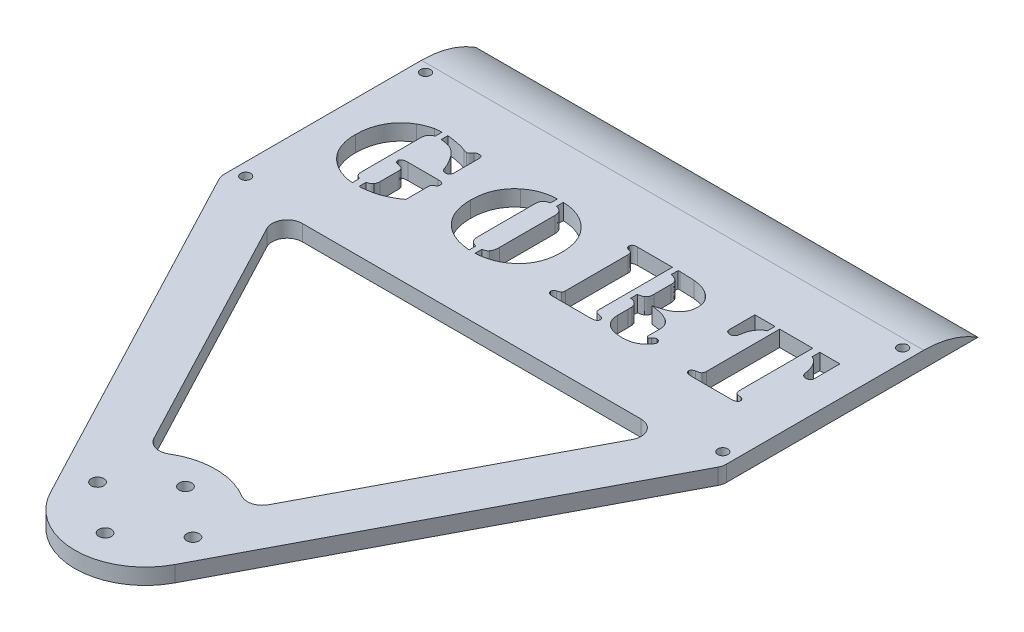
from build123d import *

# Parameters (mm, degrees)
BOSS_EXTRUDE1_DEPTH = 3.175
FILLET1_R           = 3
FILLET2_R           = 3
SKETCH2_R           = 1.25
CUT_EXTRUDE1_DEPTH  = 8.570402194
SKETCH3_R           = 1
CUT_EXTRUDE2_DEPTH  = 116.803646963
FILLET4_R           = 20
CUT_EXTRUDE3_DEPTH  = 3.175


with BuildPart() as part:
    # Sketch1 → Boss-Extrude1 (new body)
    with BuildSketch(Plane(origin=(0, 0, 0), x_dir=(1, 0, 0), z_dir=(0, 1, 0))):
        with BuildLine():
            Line((50, -25.405), (50, 25.405))
            Line((50, 25.405), (-50, 25.405))
            Line((-50, 25.405), (-50, -25.405))
            Line((-50, -25.405), (-12.391082111, -96.921217009))
            ThreePointArc((-12.391082111, -96.921217009), (0, -104.405), (12.391082111, -96.921217009))
            Line((12.391082111, -96.921217009), (50, -25.405))
        make_face()
        with BuildLine():
            Line((-38.70155175, -25.405), (-9.784896684, -80.392218324))
            ThreePointArc((-9.784896684, -80.392218324), (0, -76.405), (9.784896684, -80.392218324))
            Line((9.784896684, -80.392218324), (38.70155175, -25.405))
            Line((38.70155175, -25.405), (-38.70155175, -25.405))
        make_face(mode=Mode.SUBTRACT)
    extrude(amount=BOSS_EXTRUDE1_DEPTH)

    # Fillet1
    fillet1_edges = [part.edges().sort_by_distance(p)[0] for p in [
        (38.70155175, 1.5875, 25.405),
        (-38.70155175, 1.5875, 25.405),
        (-9.784896684, 1.5875, 80.392218324),
        (9.784896684, 1.5875, 80.392218324),
    ]]
    fillet(fillet1_edges, radius=FILLET1_R)

    # Fillet2
    fillet2_edges = [part.edges().sort_by_distance(p)[0] for p in [
        (50, 1.5875, 25.405),
        (-50, 1.5875, 25.405),
    ]]
    fillet(fillet2_edges, radius=FILLET2_R)

    # Sketch2 → Cut-Extrude1 (cut)
    with BuildSketch(Plane(origin=(0, 3.175, 0), x_dir=(1, 0, 0), z_dir=(0, 1, 0))):
        with Locations(Location((0, -82.405, 0), (0, 0, 270))):
            Circle(SKETCH2_R)
        with Locations(Location((0, -98.405, 0), (0, 0, 270))):
            Circle(SKETCH2_R)
        with Locations(Location((-9.5, -90.405, 0), (0, 0, 270))):
            Circle(SKETCH2_R)
        with Locations(Location((9.5, -90.405, 0), (0, 0, 270))):
            Circle(SKETCH2_R)
    extrude(amount=-CUT_EXTRUDE1_DEPTH, mode=Mode.SUBTRACT)

    # Sketch3 → Cut-Extrude2 (cut, through all)
    with BuildSketch(Plane(origin=(0, 3.175, 0), x_dir=(1, 0, 0), z_dir=(0, 1, 0))):
        with Locations(Location((47.5, 12.905, 0), (0, 0, 270))):
            Circle(SKETCH3_R)
        with Locations(Location((47.5, -22.905, 0), (0, 0, 270))):
            Circle(SKETCH3_R)
        with Locations(Location((-47.5, -22.905, 0), (0, 0, 90))):
            Circle(SKETCH3_R)
        with Locations(Location((-47.5, 12.905, 0), (0, 0, 90))):
            Circle(SKETCH3_R)
    extrude(amount=-CUT_EXTRUDE2_DEPTH, mode=Mode.SUBTRACT)

    # Fillet4
    # the kernel refuses this fillet: 20 mm, written as the material it takes off along each edge
    with BuildSketch(Plane(origin=(77.03231573, 3.175, -25.405), x_dir=(0, -1, 0), z_dir=(-1, 0, 0))) as fillet4_piece_1:
        with BuildLine():
            CenterArc((20, 10.812926292), FILLET4_R, 180, 32.727647126)
            Line((0, 10.812926292), (-0.4, 10.812926292))
            Line((-0.4, 10.812926292), (-0.4, 0))
            Line((-0.4, 0), (0, -0.4))
            ThreePointArc((0, -0.4), (1.5875, -0.4), (2.8385, -0.216258526))
            Line((2.8385, -0.216258526), (3.175, 0))
        make_face()
    extrude(amount=154.064631461, mode=Mode.SUBTRACT)

    # Sketch4 → Cut-Extrude3 (cut)
    with BuildSketch(Plane(origin=(0, 3.175, 0), x_dir=(1, 0, 0), z_dir=(0, 1, 0))):
        with BuildLine():
            Line((-35.551318359, 4.227423078), (-35.551318359, 2.835025833))
            add(Edge.make_bspline(
                [(-35.551318359, 2.835025833), (-35.644482488, 2.810458632), (-35.824763328, 2.762918921), (-36.067026955, 2.634129941), (-36.275114098, 2.470452994), (-36.442006407, 2.263629621), (-36.571768546, 2.020385158), (-36.66307896, 1.7395052), (-36.717902362, 1.420267767), (-36.723833534, 1.194265721), (-36.726957194, 1.075241452)],
                knots=[0, 0, 0, 0, 0.995196462, 1.925793303, 2.819334727, 3.720855559, 4.657399867, 5.660328629, 6.767809053, 8, 8, 8, 8], degree=3))
            Line((-36.726957194, 1.075241452), (-36.726957194, -10.446019127))
            add(Edge.make_bspline(
                [(-36.726957194, -10.446019127), (-36.725919843, -10.550330551), (-36.723957967, -10.747608251), (-36.681251214, -11.022791008), (-36.623911627, -11.263701748), (-36.556624577, -11.402094161), (-36.524894269, -11.467355365)],
                knots=[0, 0, 0, 0, 1.188853967, 2.248405465, 3.174006982, 4, 4, 4, 4], degree=3))
            add(Edge.make_bspline(
                [(-36.524894269, -11.467355365), (-36.490321987, -11.517104546), (-36.415804347, -11.624334714), (-36.246062205, -11.753224239), (-36.035110003, -11.875353938), (-35.873244949, -11.939794099), (-35.786446126, -11.974349612)],
                knots=[0, 0, 0, 0, 0.793365653, 1.71003282, 2.772023667, 4, 4, 4, 4], degree=3))
            Line((-35.786446126, -11.974349612), (-35.786446126, -13.366746857))
            add(Edge.make_bspline(
                [(-35.786446126, -13.366746857), (-35.935949149, -13.364296094), (-36.223548095, -13.359581563), (-36.580877702, -13.319809039), (-36.866838239, -13.261554163), (-37.110379585, -13.212116145), (-37.385260463, -13.140219806), (-37.579370829, -13.086558499), (-37.682163747, -13.058141663)],
                knots=[0, 0, 0, 0, 1.395569607, 2.684657092, 3.348359387, 4.119723616, 5.004282452, 6, 6, 6, 6], degree=3))
            add(Edge.make_bspline(
                [(-37.682163747, -13.058141663), (-37.934913895, -12.978278893), (-38.43623063, -12.819875253), (-39.15334406, -12.502285478), (-39.838199906, -12.135950476), (-40.478851961, -11.705733596), (-41.07569998, -11.224246792), (-41.618738372, -10.695078311), (-42.111272853, -10.122509878), (-42.391150203, -9.706856098), (-42.53167394, -9.498160317)],
                knots=[0, 0, 0, 0, 1.033972649, 2.050830823, 3.056106126, 4.062392446, 5.058304463, 6.045401141, 7.018614633, 8, 8, 8, 8], degree=3))
            add(Edge.make_bspline(
                [(-42.53167394, -9.498160317), (-42.632476635, -9.32948739), (-42.834209314, -8.991928543), (-43.086420911, -8.456241808), (-43.300131698, -7.898427564), (-43.477031094, -7.317991248), (-43.611618353, -6.713378401), (-43.7112912, -6.087832297), (-43.77146804, -5.438497328), (-43.777646509, -4.997796528), (-43.780790202, -4.77356175)],
                knots=[0, 0, 0, 0, 0.951873334, 1.904948656, 2.865002532, 3.845083325, 4.842920617, 5.86455084, 6.913453372, 8, 8, 8, 8], degree=3))
            add(Edge.make_bspline(
                [(-43.780790202, -4.77356175), (-43.776999477, -4.556711112), (-43.769514401, -4.12852297), (-43.71797123, -3.495315363), (-43.629268678, -2.880936207), (-43.508168271, -2.284672289), (-43.35441886, -1.706147511), (-43.164132867, -1.147054418), (-42.933349976, -0.608596573), (-42.674181567, -0.08720613), (-42.38100001, 0.41137186), (-42.057053062, 0.882897191), (-41.702887813, 1.32685836), (-41.31568953, 1.740134201), (-40.90450632, 2.133345972), (-40.456660396, 2.493020801), (-39.981141581, 2.828186929), (-39.644249337, 3.025927531), (-39.47501297, 3.12526167)],
                knots=[0, 0, 0, 0, 1.100647148, 2.173311833, 3.222026229, 4.249676371, 5.259883668, 6.258454349, 7.244409032, 8.231245038, 9.212013345, 10.17753562, 11.132758697, 12.0915749, 13.050108985, 14.017969405, 15.004335469, 16, 16, 16, 16], degree=3))
            add(Edge.make_bspline(
                [(-39.47501297, 3.12526167), (-39.273428229, 3.23409929), (-38.869378245, 3.45224992), (-38.231977677, 3.716063215), (-37.576256597, 3.941357253), (-37.125993101, 4.048597734), (-36.899629148, 4.102511452)],
                knots=[0, 0, 0, 0, 0.993812745, 1.991966358, 2.990487933, 4, 4, 4, 4], degree=3))
            add(Edge.make_bspline(
                [(-36.899629148, 4.102511452), (-36.80063764, 4.122090554), (-36.593882294, 4.162983799), (-36.268612488, 4.201910373), (-35.917784073, 4.223416452), (-35.676261966, 4.22605705), (-35.551318359, 4.227423078)],
                knots=[0, 0, 0, 0, 0.892340915, 1.863758392, 2.894884881, 4, 4, 4, 4], degree=3))
        make_face()
        with BuildLine():
            Line((-34.375679525, 2.860742933), (-34.375679525, 4.216401464))
            add(Edge.make_bspline(
                [(-34.375679525, 4.216401464), (-34.17714617, 4.198131653), (-33.788010649, 4.16232189), (-33.218654428, 4.087277081), (-32.675815452, 4.003733863), (-32.15963083, 3.908750854), (-31.6714535, 3.799804981), (-31.211463495, 3.673100498), (-30.776129977, 3.539952294), (-30.499216457, 3.434161818), (-30.363812002, 3.382432665)],
                knots=[0, 0, 0, 0, 1.163685748, 2.280883529, 3.351555557, 4.369452757, 5.344085038, 6.270107875, 7.154121834, 8, 8, 8, 8], degree=3))
            add(Edge.make_bspline(
                [(-30.363812002, 3.382432665), (-30.290631545, 3.353412981), (-30.154062165, 3.29925644), (-29.960698114, 3.236624491), (-29.793660995, 3.195159507), (-29.690449365, 3.190036351), (-29.643733215, 3.187717483)],
                knots=[0, 0, 0, 0, 1.259126468, 2.349782029, 3.253070317, 4, 4, 4, 4], degree=3))
            add(Edge.make_bspline(
                [(-29.643733215, 3.187717483), (-29.571905961, 3.190016523), (-29.443294277, 3.194133114), (-29.288700456, 3.261476502), (-29.181883669, 3.361494547), (-29.069253174, 3.474175809), (-28.925329709, 3.631588814), (-28.818272145, 3.749776026), (-28.758330218, 3.815949486)],
                knots=[0, 0, 0, 0, 1.137563862, 2.036887059, 2.603993634, 3.459282898, 4.57744306, 6, 6, 6, 6], degree=3))
            add(Edge.make_bspline(
                [(-28.758330218, 3.815949486), (-28.712331625, 3.863314287), (-28.622888303, 3.955414172), (-28.460496391, 4.057521796), (-28.278969128, 4.119396022), (-28.151411508, 4.12523491), (-28.086011759, 4.128228551)],
                knots=[0, 0, 0, 0, 1.032013047, 2.006728211, 2.978034608, 4, 4, 4, 4], degree=3))
            add(Edge.make_bspline(
                [(-28.086011759, 4.128228551), (-28.020867834, 4.126684914), (-27.900610614, 4.123835325), (-27.736356918, 4.08950007), (-27.597993973, 4.041159256), (-27.491421193, 3.960082319), (-27.409929352, 3.856883757), (-27.35966956, 3.723944909), (-27.32690302, 3.566534181), (-27.323604043, 3.451216004), (-27.321846517, 3.389780408)],
                knots=[0, 0, 0, 0, 1.261601348, 2.328945804, 3.246931812, 4.078733302, 4.89164726, 5.765503508, 6.80957516, 8, 8, 8, 8], degree=3))
            Line((-27.321846517, 3.389780408), (-27.321846517, -1.489120756))
            add(Edge.make_bspline(
                [(-27.321846517, -1.489120756), (-27.324997605, -1.565163393), (-27.330884206, -1.70721993), (-27.365163118, -1.906875931), (-27.431924899, -2.075511073), (-27.524902768, -2.215918953), (-27.646191545, -2.325496286), (-27.794282695, -2.405348482), (-27.969846889, -2.447508292), (-28.094379186, -2.452656995), (-28.159489187, -2.455348923)],
                knots=[0, 0, 0, 0, 1.247808372, 2.331051901, 3.304461783, 4.201305603, 5.068654161, 5.958272535, 6.932510852, 8, 8, 8, 8], degree=3))
            add(Edge.make_bspline(
                [(-28.159489187, -2.455348923), (-28.224623075, -2.453911047), (-28.347516192, -2.451198097), (-28.518659523, -2.413412927), (-28.664639981, -2.356481124), (-28.788639516, -2.269827721), (-28.890918165, -2.142790738), (-28.982338175, -1.975348896), (-29.080397057, -1.767913786), (-29.13357512, -1.611051309), (-29.162456067, -1.525859469)],
                knots=[0, 0, 0, 0, 1.037579167, 1.95768043, 2.781618297, 3.524611212, 4.342966149, 5.358777452, 6.565554926, 8, 8, 8, 8], degree=3))
            add(Edge.make_bspline(
                [(-29.162456067, -1.525859469), (-29.206032291, -1.402718565), (-29.298076873, -1.142612195), (-29.480206806, -0.745971593), (-29.711350217, -0.324668838), (-29.972078726, 0.116208669), (-30.252533857, 0.546734054), (-30.536666932, 0.940617046), (-30.808690556, 1.289890092), (-31.002686275, 1.493016541), (-31.094912402, 1.589583443)],
                knots=[0, 0, 0, 0, 0.84921324, 1.793764412, 2.834306527, 3.97347304, 5.12438385, 6.174302184, 7.132057974, 8, 8, 8, 8], degree=3))
            add(Edge.make_bspline(
                [(-31.094912402, 1.589583443), (-31.198283322, 1.689727411), (-31.402160681, 1.88724029), (-31.73880488, 2.142985375), (-32.096858078, 2.351339278), (-32.474974861, 2.525426541), (-32.887416114, 2.657244076), (-33.340819282, 2.759881136), (-33.842452499, 2.828359272), (-34.193012153, 2.849649275), (-34.375679525, 2.860742933)],
                knots=[0, 0, 0, 0, 0.955161076, 1.883853968, 2.798772804, 3.701283784, 4.642496082, 5.668327638, 6.785027144, 8, 8, 8, 8], degree=3))
        make_face()
        with BuildLine():
            add(Edge.make_bspline(
                [(-27.556974284, -10.934644018), (-27.662411701, -11.019399557), (-27.884646819, -11.198042564), (-28.257808177, -11.448280452), (-28.677119101, -11.705323365), (-29.13397617, -11.96092206), (-29.609772174, -12.200391248), (-30.079839732, -12.423452972), (-30.538091481, -12.613474812), (-30.841045553, -12.724793763), (-30.988370132, -12.778927439)],
                knots=[0, 0, 0, 0, 0.829494596, 1.748362538, 2.753293576, 3.846289905, 4.958301187, 6.020239977, 7.037255684, 8, 8, 8, 8], degree=3))
            add(Edge.make_bspline(
                [(-30.988370132, -12.778927439), (-31.267783249, -12.861209341), (-31.850715198, -13.032871824), (-32.602597363, -13.185006723), (-33.21873348, -13.275419081), (-33.660756283, -13.328935834), (-34.074013382, -13.358597027), (-34.340126581, -13.364108351), (-34.467526309, -13.366746857)],
                knots=[0, 0, 0, 0, 1.48053288, 3.088795292, 3.894534046, 4.646795145, 5.352163178, 6, 6, 6, 6], degree=3))
            Line((-34.467526309, -13.366746857), (-34.467526309, -11.967001869))
            add(Edge.make_bspline(
                [(-34.467526309, -11.967001869), (-34.400006491, -11.951761644), (-34.272750995, -11.92303819), (-34.096928428, -11.872643721), (-33.948158312, -11.817537154), (-33.78415433, -11.739938537), (-33.609474273, -11.610506643), (-33.505748595, -11.47618488), (-33.453537814, -11.408573423)],
                knots=[0, 0, 0, 0, 1.046463513, 1.972283685, 2.763304787, 3.442379841, 4.712610515, 6, 6, 6, 6], degree=3))
            add(Edge.make_bspline(
                [(-33.453537814, -11.408573423), (-33.414521947, -11.341078849), (-33.334524187, -11.20268862), (-33.254832427, -10.966358489), (-33.206986221, -10.7051684), (-33.202406218, -10.52216781), (-33.20004069, -10.42764977)],
                knots=[0, 0, 0, 0, 0.909043468, 1.863894056, 2.89672189, 4, 4, 4, 4], degree=3))
            Line((-33.20004069, -10.42764977), (-33.20004069, -6.728061312))
            add(Edge.make_bspline(
                [(-33.20004069, -6.728061312), (-33.202944222, -6.651973607), (-33.208377441, -6.509594891), (-33.245531844, -6.311519241), (-33.319111689, -6.146949951), (-33.392665885, -6.062865649), (-33.427820714, -6.022678012)],
                knots=[0, 0, 0, 0, 1.199986936, 2.245469215, 3.161431503, 4, 4, 4, 4], degree=3))
            add(Edge.make_bspline(
                [(-33.427820714, -6.022678012), (-33.462303253, -5.985463501), (-33.523845153, -5.919045778), (-33.633917027, -5.868094657), (-33.748508572, -5.842078614), (-33.892422188, -5.807252449), (-34.098954796, -5.769322751), (-34.256927109, -5.738727575), (-34.346288554, -5.72142056)],
                knots=[0, 0, 0, 0, 0.917242915, 1.637027764, 2.168324988, 3.062957297, 4.338579887, 6, 6, 6, 6], degree=3))
            add(Edge.make_bspline(
                [(-34.346288554, -5.72142056), (-34.455216353, -5.69461846), (-34.654684672, -5.645538518), (-34.899013318, -5.489472779), (-35.056656924, -5.271134843), (-35.072739677, -5.103033229), (-35.081062826, -5.01603726)],
                knots=[0, 0, 0, 0, 1.204604769, 2.205869305, 3.071501252, 4, 4, 4, 4], degree=3))
            add(Edge.make_bspline(
                [(-35.081062826, -5.01603726), (-35.076762114, -4.963981385), (-35.068333815, -4.861965128), (-35.002570949, -4.718683913), (-34.887449177, -4.601914756), (-34.733933363, -4.501951031), (-34.535761183, -4.427459412), (-34.298503701, -4.37388034), (-34.021404331, -4.341647218), (-33.823465587, -4.338204449), (-33.718056552, -4.336371058)],
                knots=[0, 0, 0, 0, 0.739425629, 1.449085928, 2.188922235, 3.04451434, 4.038087674, 5.183733508, 6.500243412, 8, 8, 8, 8], degree=3))
            Line((-33.718056552, -4.336371058), (-33.214736176, -4.336371058))
            Line((-33.214736176, -4.336371058), (-27.806797536, -4.336371058))
            add(Edge.make_bspline(
                [(-27.806797536, -4.336371058), (-27.706285014, -4.338444028), (-27.519468329, -4.342296934), (-27.26356317, -4.370447438), (-27.053099621, -4.414634626), (-26.888350221, -4.484606256), (-26.760503515, -4.58059272), (-26.674599198, -4.710207333), (-26.626905455, -4.868360471), (-26.620097507, -4.981406787), (-26.616463216, -5.041754359)],
                knots=[0, 0, 0, 0, 1.523296889, 2.831261925, 3.898511474, 4.7712344, 5.525094184, 6.287138452, 7.085622257, 8, 8, 8, 8], degree=3))
            add(Edge.make_bspline(
                [(-26.616463216, -5.041754359), (-26.620032307, -5.115018752), (-26.62685305, -5.255031322), (-26.720745626, -5.451425249), (-26.893461158, -5.621099747), (-27.039084982, -5.714858392), (-27.123457464, -5.769180888)],
                knots=[0, 0, 0, 0, 0.932718656, 1.782480294, 2.715198951, 4, 4, 4, 4], degree=3))
            add(Edge.make_bspline(
                [(-27.123457464, -5.769180888), (-27.204116642, -5.821481706), (-27.341515907, -5.910573787), (-27.482015403, -6.059044655), (-27.52041131, -6.196582543), (-27.541826115, -6.319393126), (-27.556453599, -6.474262499), (-27.556790107, -6.588426298), (-27.556974284, -6.650910014)],
                knots=[0, 0, 0, 0, 1.646294637, 2.804388529, 3.352667326, 4.053264048, 4.934519549, 6, 6, 6, 6], degree=3))
            Line((-27.556974284, -6.650910014), (-27.556974284, -10.934644018))
        make_face()
        with BuildLine():
            add(Edge.make_bspline(
                [(-12.555822754, 2.875438418), (-12.676835732, 2.836496879), (-12.903779238, 2.763467278), (-13.209952933, 2.619896279), (-13.459668638, 2.455853634), (-13.65730831, 2.26596647), (-13.804156345, 2.039199156), (-13.893978946, 1.767438761), (-13.960620645, 1.455629781), (-13.964518586, 1.23120507), (-13.966589355, 1.111980166)],
                knots=[0, 0, 0, 0, 1.227172696, 2.301396763, 3.25622098, 4.101163586, 4.931401698, 5.8370266, 6.85092736, 8, 8, 8, 8], degree=3))
            Line((-13.966589355, 1.111980166), (-13.966589355, -9.950046494))
            add(Edge.make_bspline(
                [(-13.966589355, -9.950046494), (-13.963713856, -10.118265367), (-13.958394238, -10.42946706), (-13.887166018, -10.855729698), (-13.784843788, -11.211290992), (-13.659875638, -11.397238054), (-13.602876091, -11.48205085)],
                knots=[0, 0, 0, 0, 1.259020734, 2.329164236, 3.23791077, 4, 4, 4, 4], degree=3))
            add(Edge.make_bspline(
                [(-13.602876091, -11.48205085), (-13.547645373, -11.541141602), (-13.42903168, -11.668045118), (-13.187215751, -11.810341072), (-12.891702706, -11.927838524), (-12.673042571, -11.982034712), (-12.555822754, -12.011088326)],
                knots=[0, 0, 0, 0, 0.809498754, 1.738482508, 2.787640608, 4, 4, 4, 4], degree=3))
            Line((-12.555822754, -12.011088326), (-12.555822754, -13.366746857))
            add(Edge.make_bspline(
                [(-12.555822754, -13.366746857), (-12.826924371, -13.343711899), (-13.360512792, -13.298373965), (-14.140231235, -13.164435056), (-14.886904859, -12.980612799), (-15.599253102, -12.745842846), (-16.280172261, -12.461606239), (-16.927142501, -12.127500363), (-17.541987768, -11.741826734), (-17.920953194, -11.443878124), (-18.110716248, -11.294683411)],
                knots=[0, 0, 0, 0, 1.083029807, 2.131644105, 3.146421699, 4.142610056, 5.115282346, 6.081478749, 7.039320145, 8, 8, 8, 8], degree=3))
            add(Edge.make_bspline(
                [(-18.110716248, -11.294683411), (-18.229517073, -11.193180304), (-18.465545911, -10.991517897), (-18.794516303, -10.667825262), (-19.103041109, -10.332079759), (-19.384556401, -9.977538804), (-19.650312932, -9.61193931), (-19.889848682, -9.228993998), (-20.101620244, -8.829418689), (-20.29889146, -8.41941976), (-20.465391079, -7.990464019), (-20.618992789, -7.549517464), (-20.742499693, -7.091300829), (-20.840363402, -6.618455632), (-20.922124161, -6.133383057), (-20.981498664, -5.632047765), (-21.013925712, -5.115672706), (-21.018242971, -4.766256631), (-21.020422363, -4.589868182)],
                knots=[0, 0, 0, 0, 0.990741463, 1.968366438, 2.92497147, 3.880787941, 4.837834284, 5.790363328, 6.742480645, 7.704838279, 8.674035295, 9.658944955, 10.665062656, 11.681084268, 12.720438081, 13.784002178, 14.881343912, 16, 16, 16, 16], degree=3))
            add(Edge.make_bspline(
                [(-21.020422363, -4.589868182), (-21.018684936, -4.412225916), (-21.01524218, -4.060223209), (-20.976298481, -3.539312843), (-20.918800788, -3.030268238), (-20.835336107, -2.535688905), (-20.722644979, -2.054561598), (-20.591694082, -1.585810967), (-20.437831752, -1.128852304), (-20.257659698, -0.68701812), (-20.050880799, -0.261060106), (-19.824189828, 0.150705303), (-19.572606894, 0.544876771), (-19.30065435, 0.92511113), (-19.003202122, 1.287918381), (-18.682970019, 1.633822026), (-18.340358527, 1.962342493), (-18.097191625, 2.166485432), (-17.974783007, 2.269249644)],
                knots=[0, 0, 0, 0, 1.096741693, 2.173221796, 3.223784728, 4.259380753, 5.26829306, 6.273798788, 7.263829866, 8.244021484, 9.218097361, 10.186166547, 11.144886776, 12.103964825, 13.071265772, 14.039836938, 15.013266817, 16, 16, 16, 16], degree=3))
            add(Edge.make_bspline(
                [(-17.974783007, 2.269249644), (-17.781070187, 2.418076562), (-17.397880724, 2.7124758), (-16.788050999, 3.096918772), (-16.154685882, 3.419386109), (-15.49783451, 3.690931006), (-14.81237107, 3.90873525), (-14.091719082, 4.068715512), (-13.336538829, 4.181124798), (-12.819490284, 4.21178698), (-12.555822754, 4.227423078)],
                knots=[0, 0, 0, 0, 0.998928617, 1.976012316, 2.943895995, 3.903054073, 4.880599994, 5.882037792, 6.919950806, 8, 8, 8, 8], degree=3))
            Line((-12.555822754, 4.227423078), (-12.555822754, 2.875438418))
        make_face()
        with BuildLine():
            Line((-11.380183919, 2.875438418), (-11.380183919, 4.227423078))
            add(Edge.make_bspline(
                [(-11.380183919, 4.227423078), (-11.117737979, 4.211767131), (-10.601912953, 4.180996111), (-9.846860647, 4.068196523), (-9.124684775, 3.909441123), (-8.437236166, 3.690168226), (-7.777746778, 3.419387153), (-7.141319216, 3.097894414), (-6.530832989, 2.712374809), (-6.147607139, 2.418042651), (-5.953875923, 2.269249644)],
                knots=[0, 0, 0, 0, 1.073847078, 2.110595406, 3.115791343, 4.092240317, 5.05494999, 6.026205051, 7.002192323, 8, 8, 8, 8], degree=3))
            add(Edge.make_bspline(
                [(-5.953875923, 2.269249644), (-5.830241584, 2.165259104), (-5.584618479, 1.958662139), (-5.239594278, 1.627685035), (-4.917926139, 1.280702859), (-4.621938627, 0.918065936), (-4.347442446, 0.540872819), (-4.099042787, 0.149080741), (-3.872716008, -0.257933606), (-3.67272087, -0.67975871), (-3.489891618, -1.114910887), (-3.336514948, -1.566953649), (-3.208490017, -2.034785618), (-3.102220671, -2.516708526), (-3.016531368, -3.013004675), (-2.95965987, -3.525865062), (-2.920757716, -4.052879156), (-2.917319335, -4.409776077), (-2.91558431, -4.589868182)],
                knots=[0, 0, 0, 0, 0.997321686, 1.981369013, 2.949866907, 3.917094678, 4.869969413, 5.828617115, 6.779720065, 7.743631752, 8.70976529, 9.692562589, 10.688679607, 11.703223735, 12.738741417, 13.796736462, 14.888221376, 16, 16, 16, 16], degree=3))
            add(Edge.make_bspline(
                [(-2.91558431, -4.589868182), (-2.91780419, -4.766249742), (-2.922201655, -5.11565217), (-2.954041991, -5.632127057), (-3.015531006, -6.132903031), (-3.089585198, -6.619347791), (-3.194594606, -7.090886971), (-3.318150946, -7.548629593), (-3.464606688, -7.992288874), (-3.639537935, -8.417301745), (-3.828747316, -8.8315908), (-4.04707263, -9.227906559), (-4.285742443, -9.610966654), (-4.547657498, -9.978467691), (-4.829144009, -10.333391871), (-5.141624722, -10.665320204), (-5.466636351, -10.99289958), (-5.702542474, -11.19345345), (-5.821616554, -11.294683411)],
                knots=[0, 0, 0, 0, 1.118908729, 2.216498289, 3.280302584, 4.318642268, 5.336525112, 6.342870037, 7.325517944, 8.297824338, 9.257102116, 10.21313445, 11.165878616, 12.118622781, 13.074655116, 14.036728391, 15.009034785, 16, 16, 16, 16], degree=3))
            add(Edge.make_bspline(
                [(-5.821616554, -11.294683411), (-6.011140238, -11.445461232), (-6.389048466, -11.746110618), (-7.005699401, -12.129134178), (-7.648057268, -12.470937877), (-8.32974716, -12.752318728), (-9.042164359, -12.989953486), (-9.791660751, -13.166016082), (-10.572697682, -13.303684882), (-11.107782144, -13.345473189), (-11.380183919, -13.366746857)],
                knots=[0, 0, 0, 0, 0.962569052, 1.919352549, 2.882414481, 3.854012492, 4.849100598, 5.866332517, 6.913788662, 8, 8, 8, 8], degree=3))
            Line((-11.380183919, -13.366746857), (-11.380183919, -12.011088326))
            add(Edge.make_bspline(
                [(-11.380183919, -12.011088326), (-11.26415447, -11.986389615), (-11.056169703, -11.942116756), (-10.777705841, -11.833482749), (-10.552626729, -11.680316497), (-10.434660163, -11.549714239), (-10.373543167, -11.48205085)],
                knots=[0, 0, 0, 0, 1.221950269, 2.190366703, 3.06245173, 4, 4, 4, 4], degree=3))
            add(Edge.make_bspline(
                [(-10.373543167, -11.48205085), (-10.310696068, -11.388694099), (-10.178375665, -11.192137645), (-10.05354195, -10.832703732), (-9.982764034, -10.412180616), (-9.974060051, -10.110802549), (-9.969417318, -9.950046494)],
                knots=[0, 0, 0, 0, 0.834931468, 1.757892895, 2.80405267, 4, 4, 4, 4], degree=3))
            Line((-9.969417318, -9.950046494), (-9.969417318, 1.111980166))
            add(Edge.make_bspline(
                [(-9.969417318, 1.111980166), (-9.973425992, 1.217433577), (-9.981068486, 1.418479335), (-10.025069887, 1.704523443), (-10.113791299, 1.955242716), (-10.199814411, 2.100183254), (-10.241283798, 2.170055117)],
                knots=[0, 0, 0, 0, 1.142336492, 2.177851851, 3.121592279, 4, 4, 4, 4], degree=3))
            add(Edge.make_bspline(
                [(-10.241283798, 2.170055117), (-10.302682789, 2.251710126), (-10.42305422, 2.411793056), (-10.673906054, 2.602545293), (-10.997304857, 2.751744784), (-11.241925531, 2.830772402), (-11.380183919, 2.875438418)],
                knots=[0, 0, 0, 0, 0.891733795, 1.748225381, 2.72730818, 4, 4, 4, 4], degree=3))
        make_face()
        with BuildLine():
            Line((10.674800618, 3.893100784), (10.674800618, -10.692168508))
            add(Edge.make_bspline(
                [(10.674800618, -10.692168508), (10.676869588, -10.767265117), (10.680711783, -10.906723788), (10.727541826, -11.09816035), (10.791973055, -11.26272759), (10.866930128, -11.344136997), (10.902580643, -11.382856323)],
                knots=[0, 0, 0, 0, 1.203529732, 2.235023121, 3.160555063, 4, 4, 4, 4], degree=3))
            add(Edge.make_bspline(
                [(10.902580643, -11.382856323), (10.940110013, -11.418085641), (11.007704062, -11.481537073), (11.117833221, -11.537284848), (11.233977776, -11.564078947), (11.37966259, -11.591334245), (11.58261008, -11.642782579), (11.740037239, -11.673961663), (11.828396225, -11.691461517)],
                knots=[0, 0, 0, 0, 0.930326789, 1.675609128, 2.203773124, 3.08839811, 4.365808078, 6, 6, 6, 6], degree=3))
            add(Edge.make_bspline(
                [(11.828396225, -11.691461517), (11.937298266, -11.715596851), (12.134966399, -11.759404904), (12.377898495, -11.909693592), (12.535049497, -12.121714733), (12.548780081, -12.286570253), (12.555822754, -12.371127719)],
                knots=[0, 0, 0, 0, 1.219102296, 2.212793001, 3.083308257, 4, 4, 4, 4], degree=3))
            add(Edge.make_bspline(
                [(12.555822754, -12.371127719), (12.55052418, -12.422223328), (12.53975524, -12.526071187), (12.460074432, -12.670208452), (12.331925635, -12.7958883), (12.222192872, -12.856365423), (12.162718519, -12.88914358)],
                knots=[0, 0, 0, 0, 0.892411273, 1.813756637, 2.815072126, 4, 4, 4, 4], degree=3))
            add(Edge.make_bspline(
                [(12.162718519, -12.88914358), (12.106880226, -12.911496773), (11.982252613, -12.961387717), (11.764187176, -13.00591559), (11.499503527, -13.029068672), (11.307988854, -13.033622139), (11.203838094, -13.036098435)],
                knots=[0, 0, 0, 0, 0.737862869, 1.64686426, 2.720302363, 4, 4, 4, 4], degree=3))
            Line((11.203838094, -13.036098435), (10.689496104, -13.036098435))
            Line((10.689496104, -13.036098435), (4.076527659, -13.036098435))
            Line((4.076527659, -13.036098435), (3.687097295, -13.036098435))
            add(Edge.make_bspline(
                [(3.687097295, -13.036098435), (3.611076301, -13.033848266), (3.466987307, -13.029583333), (3.264277685, -13.001800941), (3.088415513, -12.951792732), (2.943211471, -12.877446715), (2.823172221, -12.785814436), (2.743994899, -12.668435447), (2.685091168, -12.538031305), (2.682046642, -12.442871263), (2.680456543, -12.393170947)],
                knots=[0, 0, 0, 0, 1.359271944, 2.576342631, 3.650243983, 4.610021408, 5.482105652, 6.314522328, 7.119706436, 8, 8, 8, 8], degree=3))
            add(Edge.make_bspline(
                [(2.680456543, -12.393170947), (2.685200633, -12.314387749), (2.69431824, -12.162975307), (2.812284398, -11.963068744), (2.997543883, -11.812049152), (3.15187376, -11.757601623), (3.235211118, -11.728200231)],
                knots=[0, 0, 0, 0, 0.997972175, 1.917990238, 2.875725189, 4, 4, 4, 4], degree=3))
            add(Edge.make_bspline(
                [(3.235211118, -11.728200231), (3.303866543, -11.707632688), (3.424099493, -11.671613736), (3.580156957, -11.621571496), (3.689135619, -11.591132358), (3.775318357, -11.560989616), (3.856226354, -11.510250764), (3.900864307, -11.45216929), (3.925898933, -11.419595037)],
                knots=[0, 0, 0, 0, 1.669899031, 2.924414012, 3.818119507, 4.305705646, 5.049776651, 6, 6, 6, 6], degree=3))
            add(Edge.make_bspline(
                [(3.925898933, -11.419595037), (3.952320243, -11.382664463), (4.008417898, -11.304253564), (4.056320103, -11.156810525), (4.085491324, -10.983632441), (4.089210325, -10.858881477), (4.091223145, -10.791363035)],
                knots=[0, 0, 0, 0, 0.819358098, 1.739658973, 2.776645072, 4, 4, 4, 4], degree=3))
            Line((4.091223145, -10.791363035), (4.091223145, 1.604278928))
            add(Edge.make_bspline(
                [(4.091223145, 1.604278928), (4.089036795, 1.672979891), (4.084953303, 1.801294178), (4.057528754, 1.978588056), (4.007462332, 2.128818281), (3.952226095, 2.208992908), (3.925898933, 2.247206416)],
                knots=[0, 0, 0, 0, 1.219700243, 2.278060771, 3.179274778, 4, 4, 4, 4], degree=3))
            add(Edge.make_bspline(
                [(3.925898933, 2.247206416), (3.900856113, 2.279754779), (3.856203549, 2.33779009), (3.775377383, 2.388787489), (3.688599535, 2.418275619), (3.581096611, 2.454600009), (3.42386843, 2.502169101), (3.303782558, 2.538652646), (3.235211118, 2.559485481)],
                knots=[0, 0, 0, 0, 0.948861238, 1.691865643, 2.178752844, 3.079778033, 4.33249471, 6, 6, 6, 6], degree=3))
            add(Edge.make_bspline(
                [(3.235211118, 2.559485481), (3.151447442, 2.588368387), (2.994813733, 2.642377916), (2.813131666, 2.802277688), (2.694128444, 3.005260309), (2.685136703, 3.159086078), (2.680456543, 3.239151682)],
                knots=[0, 0, 0, 0, 1.110527578, 2.076628705, 2.998894088, 4, 4, 4, 4], degree=3))
            add(Edge.make_bspline(
                [(2.680456543, 3.239151682), (2.682102723, 3.29002594), (2.68525528, 3.387453897), (2.742952738, 3.520990042), (2.823303095, 3.639037232), (2.943100552, 3.731037567), (3.089085099, 3.804195598), (3.263484875, 3.860148629), (3.467116801, 3.886169925), (3.611121025, 3.890707023), (3.687097295, 3.893100784)],
                knots=[0, 0, 0, 0, 0.89664545, 1.717142204, 2.544538841, 3.411363823, 4.365353138, 5.439194468, 6.64892539, 8, 8, 8, 8], degree=3))
            Line((3.687097295, 3.893100784), (4.076527659, 3.893100784))
            Line((4.076527659, 3.893100784), (10.674800618, 3.893100784))
        make_face()
        with BuildLine():
            add(Edge.make_bspline(
                [(15.245096588, -4.780909493), (15.464429354, -4.809375401), (15.878033206, -4.863054608), (16.456961201, -4.952291432), (16.954553755, -5.051119285), (17.501929347, -5.185235342), (18.108965659, -5.384966125), (18.544593108, -5.618435162), (18.757317607, -5.732442174)],
                knots=[0, 0, 0, 0, 1.086194157, 2.048276208, 2.876286802, 3.57645628, 4.816541237, 6, 6, 6, 6], degree=3))
            add(Edge.make_bspline(
                [(18.757317607, -5.732442174), (18.858987668, -5.797962192), (19.056508881, -5.925252302), (19.325072225, -6.142115686), (19.550028899, -6.384651376), (19.741497057, -6.63993059), (19.893689601, -6.908643577), (20.002423336, -7.187995619), (20.066009057, -7.475899738), (20.075288954, -7.670724272), (20.079911296, -7.767766907)],
                knots=[0, 0, 0, 0, 1.142525097, 2.219659747, 3.251137804, 4.260174051, 5.22899768, 6.159470226, 7.083227077, 8, 8, 8, 8], degree=3))
            Line((20.079911296, -7.767766907), (20.079911296, -10.321107501))
            add(Edge.make_bspline(
                [(20.079911296, -10.321107501), (20.082378048, -10.374391529), (20.086807181, -10.470064696), (20.142675486, -10.595898294), (20.246087073, -10.676601784), (20.329534481, -10.681971169), (20.373821004, -10.684820765)],
                knots=[0, 0, 0, 0, 1.197177539, 2.149570356, 3.017955178, 4, 4, 4, 4], degree=3))
            add(Edge.make_bspline(
                [(20.373821004, -10.684820765), (20.408623092, -10.682207379), (20.474795358, -10.677238317), (20.573694619, -10.628691448), (20.66712621, -10.53177474), (20.73437014, -10.454898883), (20.774272982, -10.409280413)],
                knots=[0, 0, 0, 0, 0.823844728, 1.56644833, 2.555919803, 4, 4, 4, 4], degree=3))
            add(Edge.make_bspline(
                [(20.774272982, -10.409280413), (20.831126252, -10.344840119), (20.937177402, -10.224636525), (21.11524077, -10.084244049), (21.299295595, -9.995105784), (21.426161468, -9.984516089), (21.487004026, -9.979437465)],
                knots=[0, 0, 0, 0, 1.197956103, 2.234605412, 3.153348971, 4, 4, 4, 4], degree=3))
            add(Edge.make_bspline(
                [(21.487004026, -9.979437465), (21.567691341, -9.991760637), (21.744412502, -10.01875082), (21.928760999, -10.16524486), (22.057392214, -10.303659217), (22.139942782, -10.409835213), (22.18661136, -10.52327618), (22.192980652, -10.599967984), (22.196061198, -10.637060438)],
                knots=[0, 0, 0, 0, 1.391746287, 3.048199326, 3.917037675, 4.675112284, 5.359210075, 6, 6, 6, 6], degree=3))
            add(Edge.make_bspline(
                [(22.196061198, -10.637060438), (22.190920473, -10.703985207), (22.17980136, -10.848739921), (22.082872316, -11.06717459), (21.946890831, -11.309056121), (21.751703812, -11.560356454), (21.527176138, -11.822930004), (21.261872904, -12.067507717), (20.976869575, -12.30478222), (20.769389849, -12.446258235), (20.664056842, -12.518082573)],
                knots=[0, 0, 0, 0, 0.641173497, 1.386824146, 2.267516944, 3.310790122, 4.437325785, 5.586827607, 6.774884129, 8, 8, 8, 8], degree=3))
            add(Edge.make_bspline(
                [(20.664056842, -12.518082573), (20.561034566, -12.582407391), (20.356218807, -12.710289797), (20.030063841, -12.868816503), (19.691144856, -12.996287378), (19.33790182, -13.10141918), (18.961611336, -13.178035299), (18.556574301, -13.232220635), (18.118619408, -13.265469573), (17.815643084, -13.26926288), (17.65883007, -13.271226201)],
                knots=[0, 0, 0, 0, 0.926308766, 1.841569048, 2.761397571, 3.686904685, 4.650909097, 5.688344007, 6.803544326, 8, 8, 8, 8], degree=3))
            add(Edge.make_bspline(
                [(17.65883007, -13.271226201), (17.499558963, -13.268157821), (17.190282708, -13.262199571), (16.738020117, -13.223113057), (16.314526553, -13.14968569), (15.916920698, -13.049278684), (15.545415762, -12.92688646), (15.200922881, -12.771228166), (14.883140193, -12.586854909), (14.592624539, -12.374863873), (14.334868822, -12.13463329), (14.108462821, -11.873600505), (13.920099406, -11.587437177), (13.765140192, -11.280440295), (13.642472085, -10.951827536), (13.55976267, -10.599935849), (13.506915138, -10.227181732), (13.499918386, -9.971050876), (13.496333822, -9.839830353)],
                knots=[0, 0, 0, 0, 1.251360942, 2.429921104, 3.562458874, 4.624207584, 5.649542083, 6.631339062, 7.588452911, 8.5313894, 9.450462793, 10.351069925, 11.239673943, 12.13466173, 13.047925339, 13.988355124, 14.969397528, 16, 16, 16, 16], degree=3))
            Line((13.496333822, -9.839830353), (13.496333822, -7.767766907))
            add(Edge.make_bspline(
                [(13.496333822, -7.767766907), (13.496920628, -7.664886955), (13.497961564, -7.482388097), (13.492134222, -7.246127104), (13.492097266, -7.081754627), (13.484423783, -6.997461174), (13.481638336, -6.966862951)],
                knots=[0, 0, 0, 0, 1.5405853, 2.732845948, 3.540027586, 4, 4, 4, 4], degree=3))
            add(Edge.make_bspline(
                [(13.481638336, -6.966862951), (13.467293856, -6.886487666), (13.438807492, -6.726872294), (13.347497737, -6.503920649), (13.22955545, -6.294492728), (13.123956202, -6.175260692), (13.070164744, -6.114524796)],
                knots=[0, 0, 0, 0, 1.016124261, 2.017897071, 2.990331779, 4, 4, 4, 4], degree=3))
            add(Edge.make_bspline(
                [(13.070164744, -6.114524796), (12.994345807, -6.046086481), (12.83893143, -5.905800975), (12.548501422, -5.757605764), (12.215443971, -5.653057066), (11.976144366, -5.623209551), (11.850439453, -5.607530548)],
                knots=[0, 0, 0, 0, 0.905979512, 1.857085385, 2.874319514, 4, 4, 4, 4], degree=3))
            Line((11.850439453, -5.607530548), (11.850439453, -4.288610731))
            add(Edge.make_bspline(
                [(11.850439453, -4.288610731), (11.973324824, -4.271177875), (12.202452036, -4.23867326), (12.514917557, -4.162134053), (12.775045689, -4.071434125), (12.917000639, -3.983517613), (12.981991831, -3.943266823)],
                knots=[0, 0, 0, 0, 1.247078973, 2.325254223, 3.233251648, 4, 4, 4, 4], degree=3))
            add(Edge.make_bspline(
                [(12.981991831, -3.943266823), (13.070580239, -3.869853893), (13.239066228, -3.730230093), (13.37851542, -3.486767245), (13.437938546, -3.270380985), (13.476871828, -3.076656163), (13.491154684, -2.84864649), (13.494532838, -2.685570209), (13.496333822, -2.598629906)],
                knots=[0, 0, 0, 0, 1.367673077, 2.601172741, 3.273143083, 4.048698901, 4.95970948, 6, 6, 6, 6], degree=3))
            Line((13.496333822, -2.598629906), (13.496333822, 0.74459303))
            add(Edge.make_bspline(
                [(13.496333822, 0.74459303), (13.493102845, 0.867468785), (13.487031333, 1.098371652), (13.416659604, 1.419221271), (13.303759176, 1.692938972), (13.133460713, 1.92143467), (12.901049443, 2.109308793), (12.603379398, 2.270999704), (12.232456772, 2.407581087), (11.957752253, 2.477694672), (11.810026868, 2.515399025)],
                knots=[0, 0, 0, 0, 1.082725774, 2.034612004, 2.881837647, 3.67729622, 4.521414035, 5.498730348, 6.654914662, 8, 8, 8, 8], degree=3))
            Line((11.810026868, 2.515399025), (11.810026868, 3.893100784))
            Line((11.810026868, 3.893100784), (12.199457232, 3.893100784))
            add(Edge.make_bspline(
                [(12.199457232, 3.893100784), (12.466441122, 3.891602159), (12.97843058, 3.888728277), (13.71571488, 3.869480458), (14.390916876, 3.843434027), (14.820229727, 3.809882951), (15.024664307, 3.793906258)],
                knots=[0, 0, 0, 0, 1.132991815, 2.172714867, 3.129864693, 4, 4, 4, 4], degree=3))
            add(Edge.make_bspline(
                [(15.024664307, 3.793906258), (15.307424136, 3.763763471), (15.862496819, 3.704591567), (16.664221528, 3.504417297), (17.423130793, 3.229099631), (17.889469597, 2.973402107), (18.121737862, 2.846047447)],
                knots=[0, 0, 0, 0, 1.043584239, 2.048611733, 3.028076666, 4, 4, 4, 4], degree=3))
            add(Edge.make_bspline(
                [(18.121737862, 2.846047447), (18.277367136, 2.748016394), (18.579477642, 2.55771665), (18.980228303, 2.218745014), (19.321032944, 1.850731741), (19.601373499, 1.449848498), (19.814861917, 1.015312567), (19.970452879, 0.552423824), (20.065009634, 0.057744405), (20.074862476, -0.282443105), (20.079911296, -0.456762904)],
                knots=[0, 0, 0, 0, 1.092587083, 2.120950814, 3.110398021, 4.067844857, 5.018734521, 5.978946313, 6.96436623, 8, 8, 8, 8], degree=3))
            add(Edge.make_bspline(
                [(20.079911296, -0.456762904), (20.07518917, -0.600219124), (20.065946718, -0.881001016), (20.007682084, -1.293056403), (19.903428078, -1.684391332), (19.76071974, -2.057207744), (19.574367436, -2.408944714), (19.349998241, -2.742201672), (19.079457682, -3.051502639), (18.875487438, -3.238526667), (18.772013092, -3.333404177)],
                knots=[0, 0, 0, 0, 1.054064567, 2.063084088, 3.049507274, 4.023626009, 4.989524539, 5.967748163, 6.969036236, 8, 8, 8, 8], degree=3))
            add(Edge.make_bspline(
                [(18.772013092, -3.333404177), (18.678080619, -3.411486507), (18.488704547, -3.568907304), (18.17206796, -3.767823482), (17.838398457, -3.953235069), (17.468425948, -4.119801693), (17.03929531, -4.276573405), (16.52604241, -4.436443428), (15.918004477, -4.60761103), (15.479246876, -4.720607205), (15.245096588, -4.780909493)],
                knots=[0, 0, 0, 0, 0.760940985, 1.534123502, 2.327080461, 3.140514501, 4.061171224, 5.174622144, 6.492190136, 8, 8, 8, 8], degree=3))
        make_face()
        with BuildLine():
            Line((38.607979329, 3.893100784), (38.607979329, -10.692168508))
            add(Edge.make_bspline(
                [(38.607979329, -10.692168508), (38.610048299, -10.767265117), (38.613890494, -10.906723788), (38.660720537, -11.09816035), (38.725151766, -11.26272759), (38.800108839, -11.344136997), (38.835759354, -11.382856323)],
                knots=[0, 0, 0, 0, 1.203529732, 2.235023121, 3.160555063, 4, 4, 4, 4], degree=3))
            add(Edge.make_bspline(
                [(38.835759354, -11.382856323), (38.873288724, -11.418085641), (38.940882773, -11.481537073), (39.051011932, -11.537284848), (39.167156487, -11.564078947), (39.312841301, -11.591334245), (39.515788791, -11.642782579), (39.67321595, -11.673961663), (39.761574936, -11.691461517)],
                knots=[0, 0, 0, 0, 0.930326789, 1.675609128, 2.203773124, 3.08839811, 4.365808078, 6, 6, 6, 6], degree=3))
            add(Edge.make_bspline(
                [(39.761574936, -11.691461517), (39.870476977, -11.715596851), (40.06814511, -11.759404904), (40.311077206, -11.909693592), (40.468228208, -12.121714733), (40.481958792, -12.286570253), (40.489001465, -12.371127719)],
                knots=[0, 0, 0, 0, 1.219102296, 2.212793001, 3.083308257, 4, 4, 4, 4], degree=3))
            add(Edge.make_bspline(
                [(40.489001465, -12.371127719), (40.483702891, -12.422223328), (40.472933951, -12.526071187), (40.393253142, -12.670208452), (40.265104346, -12.7958883), (40.155371583, -12.856365423), (40.09589723, -12.88914358)],
                knots=[0, 0, 0, 0, 0.892411273, 1.813756637, 2.815072126, 4, 4, 4, 4], degree=3))
            add(Edge.make_bspline(
                [(40.09589723, -12.88914358), (40.040067189, -12.911535545), (39.914345792, -12.961959098), (39.692412445, -13.006037958), (39.422872406, -13.028897147), (39.22769604, -13.033573627), (39.12232132, -13.036098435)],
                knots=[0, 0, 0, 0, 0.727014662, 1.637134745, 2.724301161, 4, 4, 4, 4], degree=3))
            Line((39.12232132, -13.036098435), (38.622674815, -13.036098435))
            Line((38.622674815, -13.036098435), (32.00970637, -13.036098435))
            Line((32.00970637, -13.036098435), (31.506385994, -13.036098435))
            add(Edge.make_bspline(
                [(31.506385994, -13.036098435), (31.40100834, -13.033884624), (31.203266426, -13.029730394), (30.926189481, -13.002209267), (30.688932846, -12.952203765), (30.491126828, -12.881263571), (30.336053819, -12.785427868), (30.22198351, -12.668323678), (30.156079888, -12.525240412), (30.147670687, -12.423197298), (30.14337972, -12.371127719)],
                knots=[0, 0, 0, 0, 1.503809514, 2.821909221, 3.966789707, 4.956744027, 5.805162445, 6.546998078, 7.258576155, 8, 8, 8, 8], degree=3))
            add(Edge.make_bspline(
                [(30.14337972, -12.371127719), (30.151962275, -12.286655316), (30.168673154, -12.122181193), (30.325085185, -11.908368998), (30.57117532, -11.760477473), (30.769466084, -11.715897091), (30.878153992, -11.691461517)],
                knots=[0, 0, 0, 0, 0.915998444, 1.783517876, 2.78509317, 4, 4, 4, 4], degree=3))
            add(Edge.make_bspline(
                [(30.878153992, -11.691461517), (30.967754214, -11.674044579), (31.12647255, -11.643192117), (31.330572772, -11.591365813), (31.476213845, -11.563969921), (31.591405398, -11.537802768), (31.698435567, -11.481928683), (31.761666955, -11.418126655), (31.796621831, -11.382856323)],
                knots=[0, 0, 0, 0, 1.664705813, 2.94886922, 3.838171062, 4.369127367, 5.098439033, 6, 6, 6, 6], degree=3))
            add(Edge.make_bspline(
                [(31.796621831, -11.382856323), (31.831892503, -11.343980166), (31.906392561, -11.261864463), (31.97742289, -11.099701451), (32.016708386, -10.905963287), (32.021705665, -10.767093293), (32.024401855, -10.692168508)],
                knots=[0, 0, 0, 0, 0.838648163, 1.771424646, 2.79761262, 4, 4, 4, 4], degree=3))
            Line((32.024401855, -10.692168508), (32.024401855, 3.893100784))
            Line((32.024401855, 3.893100784), (38.607979329, 3.893100784))
        make_face()
        with BuildLine():
            Line((44.015917969, 3.893100784), (44.015917969, -1.213580404))
            add(Edge.make_bspline(
                [(44.015917969, -1.213580404), (44.01368612, -1.269092241), (44.009376454, -1.376284733), (43.958726878, -1.528617404), (43.876624052, -1.662751297), (43.764906329, -1.776255017), (43.631048568, -1.870272609), (43.47533798, -1.934750089), (43.302925812, -1.976939251), (43.182214924, -1.982305222), (43.119493357, -1.985093389)],
                knots=[0, 0, 0, 0, 1.002428969, 1.935674724, 2.871817538, 3.829023275, 4.801537112, 5.81544232, 6.864900407, 8, 8, 8, 8], degree=3))
            add(Edge.make_bspline(
                [(43.119493357, -1.985093389), (43.059190938, -1.983832215), (42.941984744, -1.981380948), (42.775170779, -1.937726482), (42.621683223, -1.875905546), (42.483857754, -1.788045282), (42.371159305, -1.672431739), (42.2766208, -1.540159013), (42.2012812, -1.389508995), (42.174378639, -1.27799068), (42.160612933, -1.220928146)],
                knots=[0, 0, 0, 0, 1.078419847, 2.096059941, 3.07107756, 4.039888765, 5.002954746, 5.947809853, 6.949919841, 8, 8, 8, 8], degree=3))
            Line((42.160612933, -1.220928146), (42.009984207, -0.467784518))
            add(Edge.make_bspline(
                [(42.009984207, -0.467784518), (41.967938823, -0.281547561), (41.885218726, 0.084855058), (41.685972801, 0.603557619), (41.443246523, 1.088676737), (41.232834116, 1.376651073), (41.128255081, 1.519779887)],
                knots=[0, 0, 0, 0, 1.043084385, 2.052164384, 3.03188803, 4, 4, 4, 4], degree=3))
            add(Edge.make_bspline(
                [(41.128255081, 1.519779887), (41.05520547, 1.603378921), (40.906768, 1.773252912), (40.648554629, 2.003607733), (40.346802861, 2.200420618), (40.129951958, 2.313915374), (40.018745931, 2.372118042)],
                knots=[0, 0, 0, 0, 0.943985185, 1.918186416, 2.932399106, 4, 4, 4, 4], degree=3))
            Line((40.018745931, 2.372118042), (40.018745931, 3.893100784))
            Line((40.018745931, 3.893100784), (44.015917969, 3.893100784))
        make_face()
        with BuildLine():
            Line((27.08671875, 3.893100784), (31.083890788, 3.893100784))
            Line((31.083890788, 3.893100784), (31.083890788, 2.372118042))
            add(Edge.make_bspline(
                [(31.083890788, 2.372118042), (30.9698166, 2.314566386), (30.750112416, 2.203723259), (30.450288946, 2.000690511), (30.188564178, 1.776832201), (30.044471136, 1.603898172), (29.974381638, 1.519779887)],
                knots=[0, 0, 0, 0, 1.08496547, 2.089617789, 3.070755045, 4, 4, 4, 4], degree=3))
            add(Edge.make_bspline(
                [(29.974381638, 1.519779887), (29.869802602, 1.376651073), (29.659390196, 1.088676737), (29.416663918, 0.603557619), (29.217417992, 0.084855058), (29.134697896, -0.281547561), (29.092652512, -0.467784518)],
                knots=[0, 0, 0, 0, 0.96811197, 1.947835616, 2.956915615, 4, 4, 4, 4], degree=3))
            Line((29.092652512, -0.467784518), (28.942023786, -1.220928146))
            add(Edge.make_bspline(
                [(28.942023786, -1.220928146), (28.928276157, -1.278010458), (28.901408923, -1.389567426), (28.825818432, -1.539942934), (28.731673753, -1.673914739), (28.615508855, -1.785559843), (28.480630477, -1.877160066), (28.327288655, -1.937480601), (28.160700234, -1.981447881), (28.043462175, -1.983854954), (27.983143361, -1.985093389)],
                knots=[0, 0, 0, 0, 1.050434425, 2.052882494, 2.998056367, 3.977109135, 4.927886351, 5.903232911, 6.921216327, 8, 8, 8, 8], degree=3))
            add(Edge.make_bspline(
                [(27.983143361, -1.985093389), (27.920432352, -1.982287711), (27.799741781, -1.976888038), (27.627187611, -1.934934424), (27.471047404, -1.869223345), (27.334687772, -1.77736153), (27.2218233, -1.663694371), (27.144626302, -1.527486744), (27.093010117, -1.376428533), (27.088865253, -1.269141303), (27.08671875, -1.213580404)],
                knots=[0, 0, 0, 0, 1.134117233, 2.182667079, 3.195694813, 4.185657135, 5.142034469, 6.066000484, 6.998438572, 8, 8, 8, 8], degree=3))
            Line((27.08671875, -1.213580404), (27.08671875, 3.893100784))
        make_face()
    extrude(amount=-CUT_EXTRUDE3_DEPTH, mode=Mode.SUBTRACT)


solid = part.part
